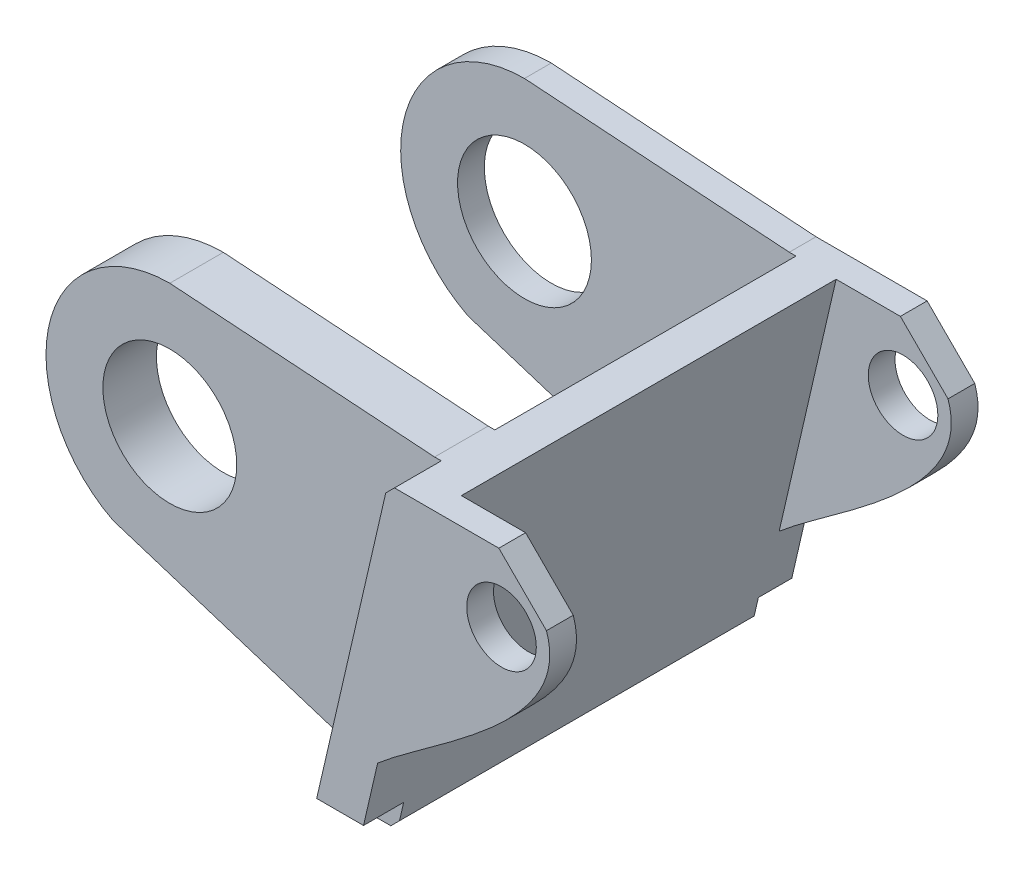
from build123d import *
from OCP.BRepFilletAPI import BRepFilletAPI_MakeChamfer

# Parameters (mm, degrees)
BOSS_EXTRU_1_DEPTH      = 320
ENL_V_MAT_EXTRU_1_DEPTH = 30
ENL_V_START             = -295
ENL_V_MAT_EXTRU_2_DEPTH = 25
ESQUISSE5_R             = 26
BOSS_EXTRU_2_DEPTH      = 20
BOSS_EXTRU_3_START      = -35
ESQUISSE5_3_R           = 50
BOSS_EXTRU_3_DEPTH      = 40
BOSS_EXTRU_4_START      = -300
ESQUISSE5_5_R           = 50
BOSS_EXTRU_4_DEPTH      = 20
BOSS_EXTRU_5_START      = -300
ESQUISSE5_6_R           = 26
BOSS_EXTRU_5_DEPTH      = 20
CHANFREIN1_SIZE         = 5
CHANFREIN1_SIZE_2       = 6.671835022
CHANFREIN2_SIZE         = 5
CHANFREIN2_SIZE2        = 6.671835022
CHANFREIN2_SIZE2_2      = 4.169025226
CHAMFER1_START          = 179.129452599
CHAMFER1_OUTLINE_W      = 53
CHAMFER1_OUTLINE_H      = 22
CHAMFER1_DEPTH          = 6.870547401
CHAMFER3_START          = 179.129452599
CHAMFER3_OUTLINE_W      = 53
CHAMFER3_OUTLINE_H      = 22
CHAMFER3_DEPTH          = 6.870547401


with BuildPart() as part:
    # Esquisse1 → Boss.-Extru.1 (new body)
    with BuildSketch(Plane.XY):
        Polygon((10.109909982, 160.217391304), (45.109909982, 160.217391304), (-12.607137799, -89.782608696), (-47.607137799, -89.782608696), align=None)
    extrude(amount=BOSS_EXTRU_1_DEPTH)

    # Esquisse2 → Enlèv. mat.-Extru.1 (cut)
    with BuildSketch(Plane.XY.offset(320)):
        Polygon((-47.607137799, -89.782608696), (-42.989773977, -69.782608696), (-7.989773977, -69.782608696), (-12.607137799, -89.782608696), align=None)
    extrude(amount=-ENL_V_MAT_EXTRU_1_DEPTH, mode=Mode.SUBTRACT)

    # Esquisse3 → Enlèv. mat.-Extru.2 (cut)
    with BuildSketch(Plane.XY.offset(320).offset(ENL_V_START)):
        Polygon((-47.607137799, -89.782608696), (-42.989773977, -69.782608696), (-7.989773977, -69.782608696), (-12.607137799, -89.782608696), align=None)
    extrude(amount=-ENL_V_MAT_EXTRU_2_DEPTH, mode=Mode.SUBTRACT)

    # Esquisse5 → Boss.-Extru.2 (add)
    with BuildSketch(Plane.XY.offset(320)):
        with BuildLine():
            Line((98.109909982, 160.217391304), (45.109909982, 160.217391304))
            Line((45.109909982, 160.217391304), (2.551706555, -24.122440094))
            add(Edge.make_bspline(
                [(98.109909982, 160.217391304), (195.681111268, 92.37740659), (50.514460477, 17.497979542), (2.551706555, -24.122440094)],
                knots=[0, 0, 0, 0, 1, 1, 1, 1], degree=3))
        make_face()
        with Locations((95.109909982, 110.217391304)):
            Circle(ESQUISSE5_R, mode=Mode.SUBTRACT)
    extrude(amount=-BOSS_EXTRU_2_DEPTH)

    # Esquisse5<3> → Boss.-Extru.3 (add)
    with BuildSketch(Plane.XY.offset(320).offset(BOSS_EXTRU_3_START)):
        with BuildLine():
            Line((-230.213971145, -0.950262244), (-40.985726083, -61.102123595))
            Line((-40.985726083, -61.102123595), (10.109909982, 160.217391304))
            Line((10.109909982, 160.217391304), (-187.731895981, 173.717391304))
            ThreePointArc((-187.731895981, 173.717391304), (-277.611698921, 103.077652588), (-230.213971145, -0.950262244))
        make_face()
        with Locations((-187.731895981, 81.217391304)):
            Circle(ESQUISSE5_3_R, mode=Mode.SUBTRACT)
    extrude(amount=-BOSS_EXTRU_3_DEPTH)

    # Esquisse5<5> → Boss.-Extru.4 (add)
    with BuildSketch(Plane.XY.offset(320).offset(BOSS_EXTRU_4_START)):
        with BuildLine():
            Line((-230.213971145, -0.950262244), (-40.985726083, -61.102123595))
            Line((-40.985726083, -61.102123595), (10.109909982, 160.217391304))
            Line((10.109909982, 160.217391304), (-187.731895981, 173.717391304))
            ThreePointArc((-187.731895981, 173.717391304), (-277.611698921, 103.077652588), (-230.213971145, -0.950262244))
        make_face()
        with Locations((-187.731895981, 81.217391304)):
            Circle(ESQUISSE5_5_R, mode=Mode.SUBTRACT)
    extrude(amount=-BOSS_EXTRU_4_DEPTH)

    # Esquisse5<6> → Boss.-Extru.5 (add)
    with BuildSketch(Plane.XY.offset(320).offset(BOSS_EXTRU_5_START)):
        with BuildLine():
            Line((98.109909982, 160.217391304), (45.109909982, 160.217391304))
            Line((45.109909982, 160.217391304), (2.551706555, -24.122440094))
            add(Edge.make_bspline(
                [(98.109909982, 160.217391304), (195.681111268, 92.37740659), (50.514460477, 17.497979542), (2.551706555, -24.122440094)],
                knots=[0, 0, 0, 0, 1, 1, 1, 1], degree=3))
        make_face()
        with Locations((95.109909982, 110.217391304)):
            Circle(ESQUISSE5_6_R, mode=Mode.SUBTRACT)
    extrude(amount=-BOSS_EXTRU_5_DEPTH)

    # Chanfrein1
    # the kernel refuses this chamfer: 6.671835022, 5 mm, written as the material it takes off along each edge
    with BuildSketch(Plane(origin=(10.109909982, 160.217391304, 20), x_dir=(1, 0, 0), z_dir=(0, 0, 1))) as chanfrein1_piece_1:
        Polygon((CHANFREIN1_SIZE, 0), (-CHANFREIN1_SIZE_2 * 0.224951054343, -CHANFREIN1_SIZE_2 * 0.974370064782), (0, 0), align=None)
    extrude(amount=225, mode=Mode.SUBTRACT)
    with BuildSketch(Plane(origin=(10.109909982, 160.217391304, 285), x_dir=(1, 0, 0), z_dir=(0, 0, 1))) as chanfrein1_piece_2:
        Polygon((CHANFREIN1_SIZE, 0), (-CHANFREIN1_SIZE_2 * 0.224951054343, -CHANFREIN1_SIZE_2 * 0.974370064782), (0, 0), align=None)
    extrude(amount=52.24901503, mode=Mode.SUBTRACT)

    # Chanfrein2: one chamfer whose edges measure the first distance from different faces: ONE call of the kernel's chamfer builder (chamfer() names one face for all edges)
    chanfrein2_edges_1 = [part.edges().sort_by_distance(p)[0] for p in [
        (-12.607137799, -89.782608696, 157.5),
    ]]
    chanfrein2_side_1 = [part.faces().sort_by_distance(p)[0] for p in [
        (-30.107137799, -89.782608696, 157.5),
    ]]
    chanfrein2_edges_2 = [part.edges().sort_by_distance(p)[0] for p in [
        (-47.607137799, -89.782608696, 157.5),
    ]]
    chanfrein2_side_2 = [part.faces().sort_by_distance(p)[0] for p in [
        (-19.722598228, 30.998601722, 155.760522115),
    ]]
    chanfrein2 = BRepFilletAPI_MakeChamfer(part.part.solid().wrapped)
    for e in chanfrein2_edges_1:
        chanfrein2.Add(CHANFREIN2_SIZE, CHANFREIN2_SIZE2, e.wrapped, chanfrein2_side_1[0].wrapped)  # the first distance lies on this face
    for e in chanfrein2_edges_2:
        chanfrein2.Add(CHANFREIN2_SIZE, CHANFREIN2_SIZE2_2, e.wrapped, chanfrein2_side_2[0].wrapped)  # the first distance lies on this face
    add(Compound.cast(chanfrein2.Shape()), mode=Mode.REPLACE)

    # Chamfer1: read off the stored shape, not the designer's step
    # Chamfer1 outline → Chamfer1 (cut)
    with BuildSketch(Plane(origin=(0, 0, 0), x_dir=(0.7071067811868629, -0.707106781186232, 0), z_dir=(0.707106781186232, 0.707106781186863, 0)).offset(CHAMFER1_START)):
        with Locations((-22.5, -310)):
            Rectangle(CHAMFER1_OUTLINE_W, CHAMFER1_OUTLINE_H)
    extrude(amount=CHAMFER1_DEPTH, mode=Mode.SUBTRACT)

    # Chamfer3: read off the stored shape, not the designer's step
    # Chamfer3 outline → Chamfer3 (cut)
    with BuildSketch(Plane(origin=(0, 0, 0), x_dir=(0.7071067811868629, -0.707106781186232, 0), z_dir=(0.707106781186232, 0.707106781186863, 0)).offset(CHAMFER3_START)):
        with Locations((-22.5, -10)):
            Rectangle(CHAMFER3_OUTLINE_W, CHAMFER3_OUTLINE_H)
    extrude(amount=CHAMFER3_DEPTH, mode=Mode.SUBTRACT)


solid = part.part
